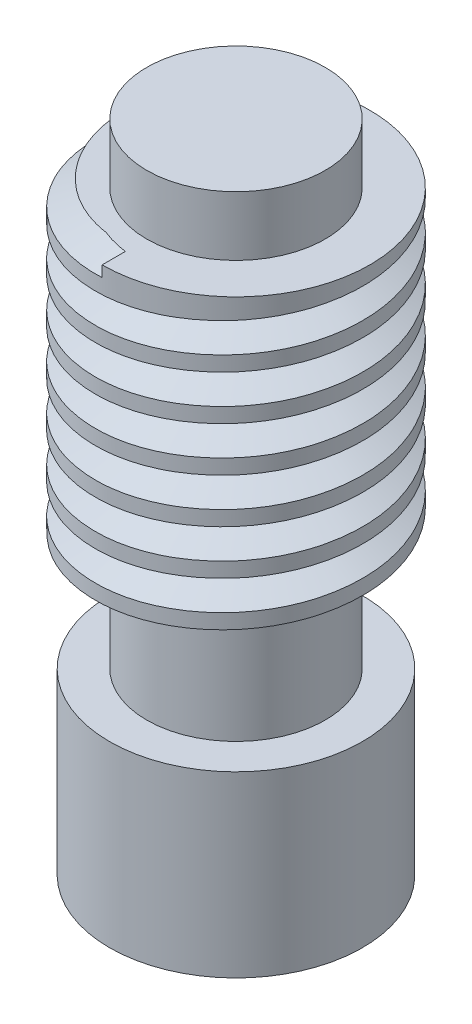
from build123d import *

# Parameters (mm, degrees)
SKETCH_1_R      = 4.25
SKETCH_1_R_2    = 2
EXTRUDE_1_DEPTH = 6
SKETCH_2_R      = 3
SKETCH_2_R_2    = 2
EXTRUDE_2_DEPTH = 4
SKETCH_3_R      = 4.5
EXTRUDE_3_DEPTH = 10
SKETCH_4_R      = 3
EXTRUDE_4_DEPTH = 2
SWEEP_1_PITCH   = 1.5


with BuildPart() as part:
    # Эскиз1 → Вытянуть1 (new body)
    with BuildSketch(Plane(origin=(0, 0, 0), x_dir=(1, 0, 0), z_dir=(0, 1, 0))):
        with Locations(Location((0, 0, 0), (0, 0, 270))):
            Circle(SKETCH_1_R)
        with Locations(Location((0, 0, 0), (0, 0, 270))):
            Circle(SKETCH_1_R_2, mode=Mode.SUBTRACT)
    extrude(amount=EXTRUDE_1_DEPTH)

    # Эскиз2 → Вытянуть2 (add)
    with BuildSketch(Plane(origin=(0, 6, 0), x_dir=(-1, 0, 0), z_dir=(0, 1, 0))):
        with Locations(Location((0, 0, 0), (0, 0, 90))):
            Circle(SKETCH_2_R)
        with Locations(Location((0, 0, 0), (0, 0, 90))):
            Circle(SKETCH_2_R_2, mode=Mode.SUBTRACT)
    extrude(amount=EXTRUDE_2_DEPTH)

    # Эскиз3 → Вытянуть3 (add)
    with BuildSketch(Plane(origin=(0, 10, 0), x_dir=(1, 0, 0), z_dir=(0, 1, 0))):
        with Locations(Location((0, 0, 0), (0, 0, 270))):
            Circle(SKETCH_3_R)
    extrude(amount=EXTRUDE_3_DEPTH)

    # Эскиз4 → Вытянуть4 (add)
    with BuildSketch(Plane(origin=(0, 20, 0), x_dir=(1, 0, 0), z_dir=(0, 1, 0))):
        with Locations(Location((0, 0, 0), (0, 0, 270))):
            Circle(SKETCH_4_R)
    extrude(amount=EXTRUDE_4_DEPTH)

    # Вырез-По траектории1: arcs per turn and ends read off the stored shape
    # Вырез-По траектории1: the profile of Эскиз6 profile screwed along a right-hand helix through 7.25 turns, 8 arcs to a turn; built about Z, then put on its axis
    sweep_1_z = Axis((0, 0, 0), (0, 0, 1))
    sweep_1_corners = [(0, -4.5003, -0.24459649), (0, -4.5003, -1.244928408), (0, -3.596161068, -0.816913528)]
    with BuildLine(mode=Mode.PRIVATE) as sweep_1_profile:
        Line(sweep_1_corners[0], sweep_1_corners[1])
        Line(sweep_1_corners[1], sweep_1_corners[2])
        Line(sweep_1_corners[2], sweep_1_corners[0])
    sweep_1_cap = Face(sweep_1_profile.wire())
    sweep_1_turn_angles = [0, 22.5, 45, 67.5, 90, 112.5, 135, 157.5, 180, 202.5, 225, 247.5, 270, 292.5, 315, 337.5, 360]
    sweep_1_turn_weights = [1, 0.9238795325112867, 1, 0.9238795325112867, 1, 0.9238795325112867, 1, 0.9238795325112867, 1, 0.9238795325112867, 1, 0.9238795325112867, 1, 0.9238795325112867, 1, 0.9238795325112867, 1]
    sweep_1_turn_rails = [Edge.make_bspline([Vector(p[0], p[1], 0).rotate(sweep_1_z, sweep_1_turn_angles[k]) / sweep_1_turn_weights[k] + Vector(0, 0, p[2] + SWEEP_1_PITCH * sweep_1_turn_angles[k] / 360) for k in range(17)], [0, 0, 0, 1, 1, 2, 2, 3, 3, 4, 4, 5, 5, 6, 6, 7, 7, 8, 8, 8], 2, sweep_1_turn_weights) for p in sweep_1_corners]
    sweep_1_turn_sides = [Face.make_surface_from_curves(sweep_1_turn_rails[p[0]], sweep_1_turn_rails[p[1]]) for p in [(0, 1), (1, 2), (2, 0)]]
    sweep_1_last_angles = [2520, 2542.5, 2565, 2587.5, 2610]
    sweep_1_last_weights = [1, 0.9238795325112867, 1, 0.9238795325112867, 1]
    sweep_1_last_rails = [Edge.make_bspline([Vector(p[0], p[1], 0).rotate(sweep_1_z, sweep_1_last_angles[k]) / sweep_1_last_weights[k] + Vector(0, 0, p[2] + SWEEP_1_PITCH * sweep_1_last_angles[k] / 360) for k in range(5)], [0, 0, 0, 1, 1, 2, 2, 2], 2, sweep_1_last_weights) for p in sweep_1_corners]
    sweep_1_last_sides = [Face.make_surface_from_curves(sweep_1_last_rails[p[0]], sweep_1_last_rails[p[1]]) for p in [(0, 1), (1, 2), (2, 0)]]
    sweep_1 = Plane(origin=(0, 10, 0), x_dir=(0, 0, 1), z_dir=(0, 1, 0)) * Solid(Shell([*[p.moved(Location((0, 0, SWEEP_1_PITCH * i))) for i in range(7) for p in sweep_1_turn_sides], *sweep_1_last_sides, sweep_1_cap, sweep_1_cap.rotate(sweep_1_z, 2610).moved(Location((0, 0, SWEEP_1_PITCH * 2610 / 360)))]))
    add(sweep_1, mode=Mode.SUBTRACT)


solid = part.part
